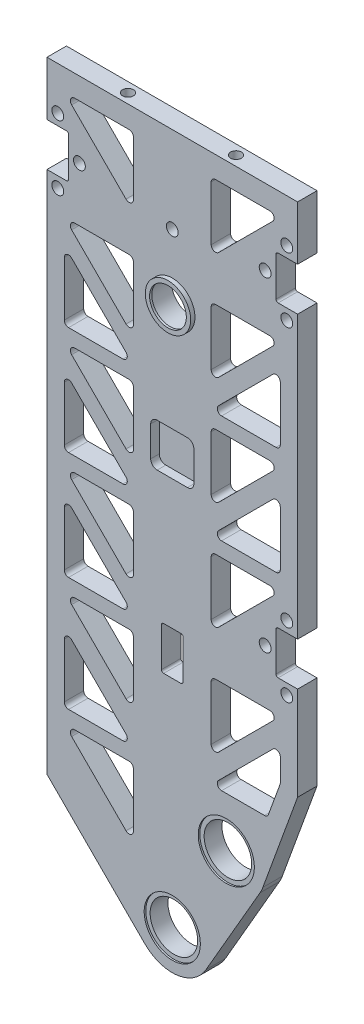
from build123d import *

# Parameters (mm, degrees)
SKETCH_1_R                   = 11
EXTRUDE_570_DEPTH            = 100
EXTRUDE_START                = -100
SKETCH_2_R                   = 11
EXTRUDE_879_DEPTH            = 100
EXTRUDE_2695_DEPTH           = 100
CUT_EXTRUDE_4152_DEPTH       = 534.010318849
CUT_EXTRUDE_4152_DEPTH_BACK  = 534.010318849
SKETCH_3_W                   = 90
SKETCH_3_H                   = 380
SKETCH_5_R                   = 2.5
EXTRUDE_4718_DEPTH           = 100
SKETCH_6_W                   = 191.177045066
SKETCH_6_H                   = 235.084722287
CUT_EXTRUDE_5032_DEPTH       = 84
SKETCH_7_R                   = 75
EXTRUDE_5320_DEPTH           = 5
CUT_EXTRUDE_6102_DEPTH       = 357.195171219
CUT_EXTRUDE_6102_DEPTH_BACK  = 357.195171219
FILLET_2_R                   = 2
MIRROR_START                 = 95
MIRROR_1_DEPTH               = 5
CUT_EXTRUDE_11155_DEPTH      = 357.195171219
CUT_EXTRUDE_11155_DEPTH_BACK = 357.195171219
SKETCH_12_W                  = 10
SKETCH_12_H                  = 20
FILLET_3_R                   = 1
CUT_EXTRUDE_START            = -5
CUT_EXTRUDE_12036_OUTLINE_R  = 5
CUT_EXTRUDE_12036_DEPTH      = 5
CUT_EXTRUDE_7_DEPTH          = 357.195171219
CUT_EXTRUDE_7_DEPTH_BACK     = 357.195171219
SKETCH_14_W                  = 10
SKETCH_14_H                  = 20
FILLET_4_R                   = 1
CUT_EXTRUDE_START_2          = -129
SKETCH_15_R                  = 11
CUT_EXTRUDE_8_DEPTH          = 129
SKETCH_16_R                  = 13
CUT_EXTRUDE_9_DEPTH          = 0.75
CUT_EXTRUDE_START_3          = -0.75
SKETCH_17_R                  = 13
CUT_EXTRUDE_10_DEPTH         = 0.75
SKETCH_18_R                  = 9.5
CUT_EXTRUDE_11_DEPTH         = 113
CUT_EXTRUDE_12_DEPTH         = 357.195171219
CUT_EXTRUDE_12_DEPTH_BACK    = 357.195171219
MOVE_FACE_1_BY               = 4
SKETCH_21_R                  = 2.5
CUT_EXTRUDE_13_DEPTH         = 17
SKETCH_22_R                  = 2.75
CUT_EXTRUDE_14_DEPTH         = 17
CUT_EXTRUDE_15_DEPTH         = 326.338285481
CUT_EXTRUDE_15_DEPTH_BACK    = 326.338285481
SKETCH_23_R                  = 2.75
SKETCH_24_W                  = 20
SKETCH_24_H                  = 20
CUT_EXTRUDE_16_DEPTH         = 4
FILLET_5_R                   = 3


# Read off the part's stored shape, not the designer's step: 镜向1, 电机安装轴承孔
with BuildPart() as part:
    # 草图1 → Extrude 570 (new body)
    with BuildSketch(Plane.XY):
        with BuildLine():
            Line((-18, 500), (-18, 0))
            ThreePointArc((-18, 0), (0, -18), (18, 0))
            Line((18, 0), (18, 500))
            ThreePointArc((18, 500), (0, 518), (-18, 500))
        make_face()
        with Locations((0, 500)):
            Circle(SKETCH_1_R, mode=Mode.SUBTRACT)
        Circle(SKETCH_1_R, mode=Mode.SUBTRACT)
    extrude(amount=EXTRUDE_570_DEPTH)

    # 草图2 → Extrude 879 (add)
    with BuildSketch(Plane.XY.offset(100).offset(EXTRUDE_START)):
        with BuildLine():
            Line((18, 61.301270189), (25, 61.301270189))
            ThreePointArc((25, 61.301270189), (40.588457268, 52.301270189), (40.588457268, 34.301270189))
            Line((40.588457268, 34.301270189), (15.588457268, -9))
            ThreePointArc((15.588457268, -9), (-4.658742812, -17.386664873), (-18, 0))
            Line((-18, 0), (-18, 61.301270189))
            Line((-18, 61.301270189), (18, 61.301270189))
        make_face()
        with Locations((25, 43.301270189)):
            Circle(SKETCH_2_R, mode=Mode.SUBTRACT)
        Circle(SKETCH_2_R, mode=Mode.SUBTRACT)
    extrude(amount=EXTRUDE_879_DEPTH)

    # 草图10 → Extrude 2695 (add)
    with BuildSketch(Plane(origin=(0, 0, 0), x_dir=(-1, 0, 0), z_dir=(0, 0, -1))):
        with BuildLine():
            Line((-41.914467174, 37.144907609), (-58, 81.339545828))
            Line((-58, 81.339545828), (-58, 320))
            Line((-58, 320), (-18, 320))
            Line((-18, 320), (-18, 61.301270189))
            Line((-18, 61.301270189), (-25, 61.301270189))
            ThreePointArc((-25, 61.301270189), (-39.744736797, 53.625646044), (-41.914467174, 37.144907609))
        make_face()
        with BuildLine():
            Line((12.727922061, -12.727922061), (58, 32.544155877))
            Line((58, 32.544155877), (58, 320))
            Line((58, 320), (18, 320))
            Line((18, 320), (18, 0))
            ThreePointArc((18, 0), (16.629831585, -6.888301783), (12.727922061, -12.727922061))
        make_face()
    extrude(amount=-EXTRUDE_2695_DEPTH)

    # 草图3 → Cut-Extrude 4152 (cut, two sides: drawn at the far end of the back side and taken through both)
    with BuildSketch(Plane.ZY.offset(18).offset(-CUT_EXTRUDE_4152_DEPTH_BACK)):
        with Locations((50, 150)):
            Rectangle(SKETCH_3_W, SKETCH_3_H)
    extrude(amount=CUT_EXTRUDE_4152_DEPTH + CUT_EXTRUDE_4152_DEPTH_BACK, mode=Mode.SUBTRACT)

    # 草图5 → Extrude 4718 (add)
    with BuildSketch(Plane.XY.offset(100)):
        with Locations(Location((0, 250, 0), (0, 0, 90))):
            Circle(SKETCH_5_R)
    extrude(amount=-EXTRUDE_4718_DEPTH)

    # 草图6 → Cut-Extrude 5032 (cut)
    with BuildSketch(Plane(origin=(18, 0, 0), x_dir=(0, 0, -1), z_dir=(1, 0, 0))):
        with Locations((-50.962374235, 437.542361144)):
            Rectangle(SKETCH_6_W, SKETCH_6_H)
    extrude(amount=-CUT_EXTRUDE_5032_DEPTH, mode=Mode.SUBTRACT)

    # 草图7 → Extrude 5320 (add)
    with BuildSketch(Plane(origin=(0, 320, 0), x_dir=(1, 0, 0), z_dir=(0, 1, 0))):
        with Locations(Location((0, -50, 0), (0, 0, 320.654170234))):
            Circle(SKETCH_7_R)
    extrude(amount=EXTRUDE_5320_DEPTH)

    # 草图10<3> → Cut-Extrude 6102 (cut, two sides: drawn at the far end of the back side and taken through both)
    with BuildSketch(Plane(origin=(0, 0, 0), x_dir=(-1, 0, 0), z_dir=(0, 0, -1)).offset(-CUT_EXTRUDE_6102_DEPTH_BACK)):
        Polygon((50, 310), (18, 310), (18, 278), align=None)
        Polygon((-18, 278), (-18, 310), (-50, 310), align=None)
        Polygon((-18, 227.925713543), (-18, 259.925713543), (-50, 259.925713543), align=None)
        Polygon((50, 259.925713543), (18, 259.925713543), (18, 227.925713543), align=None)
        Polygon((50, 248.612005044), (50, 216.612005044), (18, 216.612005044), align=None)
        Polygon((-50, 248.612005044), (-50, 216.612005044), (-18, 216.612005044), align=None)
        Polygon((-18, 177.851427085), (-18, 209.851427085), (-50, 209.851427085), align=None)
        Polygon((50, 209.851427085), (18, 209.851427085), (18, 177.851427085), align=None)
        Polygon((50, 198.537718586), (50, 166.537718586), (18, 166.537718586), align=None)
        Polygon((-50, 198.537718586), (-50, 166.537718586), (-18, 166.537718586), align=None)
        Polygon((-50, 159.777140628), (-18, 127.777140628), (-18, 159.777140628), align=None)
        Polygon((18, 159.777140628), (18, 127.777140628), (50, 159.777140628), align=None)
        Polygon((-50, 109.702854171), (-18, 77.702854171), (-18, 109.702854171), align=None)
        Polygon((18, 109.702854171), (18, 77.702854171), (50, 109.702854171), align=None)
        Polygon((-50, 98.389145672), (-50, 82.750161674), (-44.045077173, 66.389145672), (-18, 66.389145672), align=None)
        Polygon((18, 56.800140588), (18, 24.800140588), (50, 56.800140588), align=None)
        Polygon((50, 95.560718547), (50, 63.560718547), (18, 63.560718547), align=None)
        Polygon((50, 116.463432129), (18, 116.463432129), (50, 148.463432129), align=None)
    extrude(amount=CUT_EXTRUDE_6102_DEPTH + CUT_EXTRUDE_6102_DEPTH_BACK, mode=Mode.SUBTRACT)

    # 圆角2
    fillet_2_edges = [part.edges().sort_by_distance(p)[0] for p in [
        (50, 109.702854171, 2.5),
        (18, 109.702854171, 2.5),
        (18, 77.702854171, 2.5),
        (-18, 159.777140628, 2.5),
        (-50, 159.777140628, 2.5),
        (-18, 127.777140628, 2.5),
        (50, 159.777140628, 2.5),
        (18, 159.777140628, 2.5),
        (18, 127.777140628, 2.5),
        (50, 166.537718586, 2.5),
        (50, 198.537718586, 2.5),
        (18, 166.537718586, 2.5),
        (-50, 63.560718547, 2.5),
        (-18, 63.560718547, 2.5),
        (-50, 95.560718547, 2.5),
        (-50, 56.800140588, 2.5),
        (-18, 24.800140588, 2.5),
        (-18, 56.800140588, 2.5),
        (50, 82.750161674, 2.5),
        (50, 98.389145672, 2.5),
        (18, 66.389145672, 2.5),
        (44.045077173, 66.389145672, 2.5),
        (-18, 109.702854171, 2.5),
        (-50, 109.702854171, 2.5),
        (-18, 77.702854171, 2.5),
        (50, 310, 2.5),
        (18, 310, 2.5),
        (18, 278, 2.5),
        (50, 259.925713543, 2.5),
        (18, 259.925713543, 2.5),
        (18, 227.925713543, 2.5),
        (-50, 248.612005044, 2.5),
        (-50, 216.612005044, 2.5),
        (-18, 216.612005044, 2.5),
        (-18, 259.925713543, 2.5),
        (-50, 259.925713543, 2.5),
        (-18, 227.925713543, 2.5),
        (50, 216.612005044, 2.5),
        (50, 248.612005044, 2.5),
        (18, 216.612005044, 2.5),
        (50, 209.851427085, 2.5),
        (18, 209.851427085, 2.5),
        (18, 177.851427085, 2.5),
        (-50, 198.537718586, 2.5),
        (-50, 166.537718586, 2.5),
        (-18, 166.537718586, 2.5),
        (-18, 209.851427085, 2.5),
        (-50, 209.851427085, 2.5),
        (-18, 177.851427085, 2.5),
        (-50, 148.463432129, 2.5),
        (-50, 116.463432129, 2.5),
        (-18, 116.463432129, 2.5),
        (-18, 310, 2.5),
        (-50, 310, 2.5),
        (-18, 278, 2.5),
    ]]
    fillet(fillet_2_edges, radius=FILLET_2_R)

    # 镜向1 outline → 镜向1 (add)
    with BuildSketch(Plane.XY.offset(MIRROR_START)):
        with BuildLine():
            ThreePointArc((-50, 143.635005004), (-48.765366865, 145.482764069), (-46.585786438, 145.049218567))
            Line((-46.585786438, 145.049218567), (-50, 148.463432129))
            Line((-50, 148.463432129), (-50, 143.635005004))
        make_face()
        with BuildLine():
            Line((-18, 116.463432129), (-21.414213562, 119.877645691))
            ThreePointArc((-21.414213562, 119.877645691), (-20.98066806, 117.698065264), (-22.828427125, 116.463432129))
            Line((-22.828427125, 116.463432129), (-18, 116.463432129))
        make_face()
        with BuildLine():
            ThreePointArc((-48, 116.463432129), (-49.414213562, 117.049218567), (-50, 118.463432129))
            Line((-50, 118.463432129), (-50, 116.463432129))
            Line((-50, 116.463432129), (-48, 116.463432129))
        make_face()
        with BuildLine():
            ThreePointArc((-20, 310), (-18.585786438, 309.414213562), (-18, 308))
            Line((-18, 308), (-18, 310))
            Line((-18, 310), (-20, 310))
        make_face()
        with BuildLine():
            Line((-18, 278), (-18, 282.828427125))
            ThreePointArc((-18, 282.828427125), (-19.234633135, 280.98066806), (-21.414213562, 281.414213562))
            Line((-21.414213562, 281.414213562), (-18, 278))
        make_face()
        with BuildLine():
            ThreePointArc((-46.585786438, 306.585786438), (-47.01933194, 308.765366865), (-45.171572875, 310))
            Line((-45.171572875, 310), (-50, 310))
            Line((-50, 310), (-46.585786438, 306.585786438))
        make_face()
        with BuildLine():
            ThreePointArc((-20, 259.925713543), (-18.585786438, 259.339927105), (-18, 257.925713543))
            Line((-18, 257.925713543), (-18, 259.925713543))
            Line((-18, 259.925713543), (-20, 259.925713543))
        make_face()
        with BuildLine():
            Line((-18, 227.925713543), (-18, 232.754140667))
            ThreePointArc((-18, 232.754140667), (-19.234633135, 230.906381602), (-21.414213562, 231.339927105))
            Line((-21.414213562, 231.339927105), (-18, 227.925713543))
        make_face()
        with BuildLine():
            ThreePointArc((-46.585786438, 256.51149998), (-47.01933194, 258.691080407), (-45.171572875, 259.925713543))
            Line((-45.171572875, 259.925713543), (-50, 259.925713543))
            Line((-50, 259.925713543), (-46.585786438, 256.51149998))
        make_face()
        with BuildLine():
            ThreePointArc((-50, 243.783577919), (-48.765366865, 245.631336984), (-46.585786438, 245.197791481))
            Line((-46.585786438, 245.197791481), (-50, 248.612005044))
            Line((-50, 248.612005044), (-50, 243.783577919))
        make_face()
        with BuildLine():
            Line((-18, 216.612005044), (-21.414213562, 220.026218606))
            ThreePointArc((-21.414213562, 220.026218606), (-20.98066806, 217.846638179), (-22.828427125, 216.612005044))
            Line((-22.828427125, 216.612005044), (-18, 216.612005044))
        make_face()
        with BuildLine():
            ThreePointArc((-48, 216.612005044), (-49.414213563, 217.197791481), (-50, 218.612005044))
            Line((-50, 218.612005044), (-50, 216.612005044))
            Line((-50, 216.612005044), (-48, 216.612005044))
        make_face()
        with BuildLine():
            ThreePointArc((-20, 209.851427085), (-18.585786438, 209.265640647), (-18, 207.851427085))
            Line((-18, 207.851427085), (-18, 209.851427085))
            Line((-18, 209.851427085), (-20, 209.851427085))
        make_face()
        with BuildLine():
            Line((-18, 177.851427085), (-18, 182.67985421))
            ThreePointArc((-18, 182.67985421), (-19.234633135, 180.832095145), (-21.414213562, 181.265640648))
            Line((-21.414213562, 181.265640648), (-18, 177.851427085))
        make_face()
        with BuildLine():
            ThreePointArc((-46.585786438, 206.437213523), (-47.01933194, 208.61679395), (-45.171572875, 209.851427085))
            Line((-45.171572875, 209.851427085), (-50, 209.851427085))
            Line((-50, 209.851427085), (-46.585786438, 206.437213523))
        make_face()
        with BuildLine():
            ThreePointArc((-50, 193.709291462), (-48.765366865, 195.557050527), (-46.585786438, 195.123505024))
            Line((-46.585786438, 195.123505024), (-50, 198.537718586))
            Line((-50, 198.537718586), (-50, 193.709291462))
        make_face()
        with BuildLine():
            Line((-18, 166.537718586), (-21.414213562, 169.951932149))
            ThreePointArc((-21.414213562, 169.951932149), (-20.98066806, 167.772351722), (-22.828427125, 166.537718586))
            Line((-22.828427125, 166.537718586), (-18, 166.537718586))
        make_face()
        with BuildLine():
            ThreePointArc((-48, 166.537718586), (-49.414213562, 167.123505024), (-50, 168.537718586))
            Line((-50, 168.537718586), (-50, 166.537718586))
            Line((-50, 166.537718586), (-48, 166.537718586))
        make_face()
        with BuildLine():
            ThreePointArc((-20, 159.777140628), (-18.585786438, 159.19135419), (-18, 157.777140628))
            Line((-18, 157.777140628), (-18, 159.777140628))
            Line((-18, 159.777140628), (-20, 159.777140628))
        make_face()
        with BuildLine():
            Line((-18, 127.777140628), (-18, 132.605567753))
            ThreePointArc((-18, 132.605567753), (-19.234633135, 130.757808688), (-21.414213562, 131.19135419))
            Line((-21.414213562, 131.19135419), (-18, 127.777140628))
        make_face()
        with BuildLine():
            ThreePointArc((-46.585786438, 156.362927066), (-47.01933194, 158.542507493), (-45.171572875, 159.777140628))
            Line((-45.171572875, 159.777140628), (-50, 159.777140628))
            Line((-50, 159.777140628), (-46.585786438, 156.362927066))
        make_face()
        with BuildLine():
            ThreePointArc((-20, 109.702854171), (-18.585786438, 109.117067733), (-18, 107.702854171))
            Line((-18, 107.702854171), (-18, 109.702854171))
            Line((-18, 109.702854171), (-20, 109.702854171))
        make_face()
        with BuildLine():
            Line((-18, 77.702854171), (-18, 82.531281295))
            ThreePointArc((-18, 82.531281295), (-19.234633135, 80.68352223), (-21.414213562, 81.117067733))
            Line((-21.414213562, 81.117067733), (-18, 77.702854171))
        make_face()
        with BuildLine():
            ThreePointArc((-46.585786438, 106.288640608), (-47.01933194, 108.468221035), (-45.171572875, 109.702854171))
            Line((-45.171572875, 109.702854171), (-50, 109.702854171))
            Line((-50, 109.702854171), (-46.585786438, 106.288640608))
        make_face()
        with BuildLine():
            ThreePointArc((-50, 90.732291422), (-48.765366865, 92.580050487), (-46.585786438, 92.146504984))
            Line((-46.585786438, 92.146504984), (-50, 95.560718547))
            Line((-50, 95.560718547), (-50, 90.732291422))
        make_face()
        with BuildLine():
            Line((-18, 63.560718547), (-21.414213562, 66.974932109))
            ThreePointArc((-21.414213562, 66.974932109), (-20.98066806, 64.795351682), (-22.828427125, 63.560718547))
            Line((-22.828427125, 63.560718547), (-18, 63.560718547))
        make_face()
        with BuildLine():
            ThreePointArc((-48, 63.560718547), (-49.414213562, 64.146504984), (-50, 65.560718547))
            Line((-50, 65.560718547), (-50, 63.560718547))
            Line((-50, 63.560718547), (-48, 63.560718547))
        make_face()
        with BuildLine():
            ThreePointArc((-46.585786438, 53.385927026), (-47.01933194, 55.565507453), (-45.171572875, 56.800140588))
            Line((-45.171572875, 56.800140588), (-50, 56.800140588))
            Line((-50, 56.800140588), (-46.585786438, 53.385927026))
        make_face()
        with BuildLine():
            Line((-18, 56.800140588), (-20, 56.800140588))
            ThreePointArc((-20, 56.800140588), (-18.585786437, 56.214354151), (-18, 54.800140588))
            Line((-18, 54.800140588), (-18, 56.800140588))
        make_face()
        with BuildLine():
            ThreePointArc((-18, 29.628567713), (-19.234633135, 27.780808648), (-21.414213562, 28.214354151))
            Line((-21.414213562, 28.214354151), (-18, 24.800140588))
            Line((-18, 24.800140588), (-18, 29.628567713))
        make_face()
        with BuildLine():
            ThreePointArc((46.585786438, 94.974932109), (48.765366865, 95.408477612), (50, 93.560718547))
            Line((50, 93.560718547), (50, 98.389145672))
            Line((50, 98.389145672), (46.585786438, 94.974932109))
        make_face()
        with BuildLine():
            Line((50, 82.750161674), (50, 83.102815635))
            ThreePointArc((50, 83.102815635), (49.969615506, 82.75551928), (49.879385242, 82.418775349))
            Line((49.879385242, 82.418775349), (50, 82.750161674))
        make_face()
        with BuildLine():
            ThreePointArc((22.828427125, 66.389145672), (20.98066806, 67.623778807), (21.414213562, 69.803359234))
            Line((21.414213562, 69.803359234), (18, 66.389145672))
            Line((18, 66.389145672), (22.828427125, 66.389145672))
        make_face()
        with BuildLine():
            Line((44.045077173, 66.389145672), (44.524047338, 67.705105385))
            ThreePointArc((44.524047338, 67.705105385), (43.791814969, 66.750841583), (42.644662096, 66.389145672))
            Line((42.644662096, 66.389145672), (44.045077173, 66.389145672))
        make_face()
        with BuildLine():
            Line((18, 109.702854171), (18, 107.702854171))
            ThreePointArc((18, 107.702854171), (18.585786438, 109.117067733), (20, 109.702854171))
            Line((20, 109.702854171), (18, 109.702854171))
        make_face()
        with BuildLine():
            ThreePointArc((21.414213562, 81.117067733), (19.234633135, 80.68352223), (18, 82.531281295))
            Line((18, 82.531281295), (18, 77.702854171))
            Line((18, 77.702854171), (21.414213562, 81.117067733))
        make_face()
        with BuildLine():
            Line((50, 109.702854171), (45.171572875, 109.702854171))
            ThreePointArc((45.171572875, 109.702854171), (47.01933194, 108.468221035), (46.585786438, 106.288640608))
            Line((46.585786438, 106.288640608), (50, 109.702854171))
        make_face()
        with BuildLine():
            Line((18, 159.777140628), (18, 157.777140628))
            ThreePointArc((18, 157.777140628), (18.585786438, 159.19135419), (20, 159.777140628))
            Line((20, 159.777140628), (18, 159.777140628))
        make_face()
        with BuildLine():
            ThreePointArc((21.414213562, 131.19135419), (19.234633135, 130.757808688), (18, 132.605567753))
            Line((18, 132.605567753), (18, 127.777140628))
            Line((18, 127.777140628), (21.414213562, 131.19135419))
        make_face()
        with BuildLine():
            Line((50, 159.777140628), (45.171572875, 159.777140628))
            ThreePointArc((45.171572875, 159.777140628), (47.01933194, 158.542507493), (46.585786438, 156.362927066))
            Line((46.585786438, 156.362927066), (50, 159.777140628))
        make_face()
        with BuildLine():
            ThreePointArc((50, 168.537718586), (49.414213562, 167.123505024), (48, 166.537718586))
            Line((48, 166.537718586), (50, 166.537718586))
            Line((50, 166.537718586), (50, 168.537718586))
        make_face()
        with BuildLine():
            Line((18, 166.537718586), (22.828427125, 166.537718586))
            ThreePointArc((22.828427125, 166.537718586), (20.98066806, 167.772351722), (21.414213562, 169.951932149))
            Line((21.414213562, 169.951932149), (18, 166.537718586))
        make_face()
        with BuildLine():
            ThreePointArc((46.585786438, 195.123505024), (48.765366865, 195.557050527), (50, 193.709291462))
            Line((50, 193.709291462), (50, 198.537718586))
            Line((50, 198.537718586), (46.585786438, 195.123505024))
        make_face()
        with BuildLine():
            Line((18, 177.851427085), (21.414213562, 181.265640648))
            ThreePointArc((21.414213562, 181.265640648), (19.234633135, 180.832095145), (18, 182.67985421))
            Line((18, 182.67985421), (18, 177.851427085))
        make_face()
        with BuildLine():
            ThreePointArc((45.171572875, 209.851427085), (47.01933194, 208.61679395), (46.585786438, 206.437213523))
            Line((46.585786438, 206.437213523), (50, 209.851427085))
            Line((50, 209.851427085), (45.171572875, 209.851427085))
        make_face()
        with BuildLine():
            Line((18, 209.851427085), (18, 207.851427085))
            ThreePointArc((18, 207.851427085), (18.585786438, 209.265640647), (20, 209.851427085))
            Line((20, 209.851427085), (18, 209.851427085))
        make_face()
        with BuildLine():
            ThreePointArc((50, 218.612005044), (49.414213563, 217.197791481), (48, 216.612005044))
            Line((48, 216.612005044), (50, 216.612005044))
            Line((50, 216.612005044), (50, 218.612005044))
        make_face()
        with BuildLine():
            Line((18, 216.612005044), (22.828427125, 216.612005044))
            ThreePointArc((22.828427125, 216.612005044), (20.98066806, 217.846638179), (21.414213562, 220.026218606))
            Line((21.414213562, 220.026218606), (18, 216.612005044))
        make_face()
        with BuildLine():
            ThreePointArc((46.585786438, 245.197791481), (48.765366865, 245.631336984), (50, 243.783577919))
            Line((50, 243.783577919), (50, 248.612005044))
            Line((50, 248.612005044), (46.585786438, 245.197791481))
        make_face()
        with BuildLine():
            Line((18, 227.925713543), (21.414213562, 231.339927105))
            ThreePointArc((21.414213562, 231.339927105), (19.234633135, 230.906381602), (18, 232.754140667))
            Line((18, 232.754140667), (18, 227.925713543))
        make_face()
        with BuildLine():
            ThreePointArc((45.171572875, 259.925713543), (47.01933194, 258.691080407), (46.585786438, 256.51149998))
            Line((46.585786438, 256.51149998), (50, 259.925713543))
            Line((50, 259.925713543), (45.171572875, 259.925713543))
        make_face()
        with BuildLine():
            Line((18, 259.925713543), (18, 257.925713543))
            ThreePointArc((18, 257.925713543), (18.585786438, 259.339927105), (20, 259.925713543))
            Line((20, 259.925713543), (18, 259.925713543))
        make_face()
        with BuildLine():
            Line((18, 278), (21.414213562, 281.414213562))
            ThreePointArc((21.414213562, 281.414213562), (19.234633135, 280.98066806), (18, 282.828427125))
            Line((18, 282.828427125), (18, 278))
        make_face()
        with BuildLine():
            ThreePointArc((45.171572875, 310), (47.01933194, 308.765366865), (46.585786438, 306.585786438))
            Line((46.585786438, 306.585786438), (50, 310))
            Line((50, 310), (45.171572875, 310))
        make_face()
        with BuildLine():
            Line((18, 310), (18, 308))
            ThreePointArc((18, 308), (18.585786438, 309.414213562), (20, 310))
            Line((20, 310), (18, 310))
        make_face()
    extrude(amount=MIRROR_1_DEPTH)

    # 草图12 → Cut-Extrude 11155 (cut, two sides: drawn at the far end of the back side and taken through both)
    with BuildSketch(Plane(origin=(0, 0, 0), x_dir=(-1, 0, 0), z_dir=(0, 0, -1)).offset(-CUT_EXTRUDE_11155_DEPTH_BACK)):
        with Locations((-53, 285)):
            Rectangle(SKETCH_12_W, SKETCH_12_H)
        with Locations((-53, 134.702854171)):
            Rectangle(SKETCH_12_W, SKETCH_12_H)
        with Locations((53, 285)):
            Rectangle(SKETCH_12_W, SKETCH_12_H)
    extrude(amount=CUT_EXTRUDE_11155_DEPTH + CUT_EXTRUDE_11155_DEPTH_BACK, mode=Mode.SUBTRACT)

    # 圆角3
    fillet_3_edges = [part.edges().sort_by_distance(p)[0] for p in [
        (-48, 275, 2.5),
        (-48, 295, 2.5),
        (-48, 275, 97.5),
        (-48, 295, 97.5),
        (48, 144.702854171, 2.5),
        (48, 124.702854171, 2.5),
        (48, 144.702854171, 97.5),
        (48, 124.702854171, 97.5),
        (48, 295, 2.5),
        (48, 275, 2.5),
        (48, 295, 97.5),
        (48, 275, 97.5),
    ]]
    fillet(fillet_3_edges, radius=FILLET_3_R)

    # Cut-Extrude 12036 outline → Cut-Extrude 12036 (cut)
    with BuildSketch(Plane.XY.offset(5).offset(CUT_EXTRUDE_START)):
        with Locations((0, 250)):
            Circle(CUT_EXTRUDE_12036_OUTLINE_R)
    cut_extrude_12036 = extrude(amount=CUT_EXTRUDE_12036_DEPTH, mode=Mode.SUBTRACT)

    # 镜向2: Cut-Extrude 12036 across plane
    add(cut_extrude_12036.mirror(Plane(origin=(0, 0, 50), x_dir=(1, 0, 0), z_dir=(0, 0, -1))), mode=Mode.SUBTRACT)

    # 草图14 → 切除-拉伸7 (cut, two sides: drawn at the far end of the back side and taken through both)
    with BuildSketch(Plane(origin=(0, 0, 0), x_dir=(-1, 0, 0), z_dir=(0, 0, -1)).offset(-CUT_EXTRUDE_7_DEPTH_BACK)):
        with Locations((0, 110)):
            Rectangle(SKETCH_14_W, SKETCH_14_H)
    extrude(amount=CUT_EXTRUDE_7_DEPTH + CUT_EXTRUDE_7_DEPTH_BACK, mode=Mode.SUBTRACT)

    # 圆角4
    fillet_4_edges = [part.edges().sort_by_distance(p)[0] for p in [
        (5, 100, 2.5),
        (5, 120, 2.5),
        (-5, 120, 2.5),
        (-5, 100, 2.5),
        (5, 100, 97.5),
        (5, 120, 97.5),
        (-5, 120, 97.5),
        (-5, 100, 97.5),
    ]]
    fillet(fillet_4_edges, radius=FILLET_4_R)

    # 草图15 → 切除-拉伸8 (cut)
    with BuildSketch(Plane.XY.offset(100).offset(CUT_EXTRUDE_START_2)):
        with Locations((25, 43.301270189)):
            Circle(SKETCH_15_R)
    extrude(amount=CUT_EXTRUDE_8_DEPTH, mode=Mode.SUBTRACT)

    # 草图16 → 切除-拉伸9 (cut)
    with BuildSketch(Plane.XY.offset(100)):
        with Locations((25, 43.301270189)):
            Circle(SKETCH_16_R)
        Circle(SKETCH_16_R)
    extrude(amount=-CUT_EXTRUDE_9_DEPTH, mode=Mode.SUBTRACT)

    # 草图17 → 切除-拉伸10 (cut)
    with BuildSketch(Plane(origin=(0, 0, 0), x_dir=(-1, 0, 0), z_dir=(0, 0, -1)).offset(CUT_EXTRUDE_START_3)):
        with Locations(Location((0, 0, 0), (0, 0, 180))):
            Circle(SKETCH_17_R)
        with Locations(Location((-25, 43.301270189, 0), (0, 0, 180))):
            Circle(SKETCH_17_R)
    extrude(amount=CUT_EXTRUDE_10_DEPTH, mode=Mode.SUBTRACT)

    # 草图18 → 切除-拉伸11 (cut)
    with BuildSketch(Plane.XY.offset(100)):
        with Locations((0, 250)):
            Circle(SKETCH_18_R)
    extrude(amount=-CUT_EXTRUDE_11_DEPTH, mode=Mode.SUBTRACT)

    # 草图19 → 旋转1 (revolve)
    with BuildSketch(Plane(origin=(0, 0, 0), x_dir=(0, 0, -1), z_dir=(1, 0, 0)), mode=Mode.PRIVATE) as revolve_1_sk:
        Polygon((0, 239.5), (2, 239.5), (2, 241.5), (1, 241.5), (1, 240.5), (0, 240.5), align=None)
        Polygon((-100, 239.5), (-102, 239.5), (-102, 241.5), (-101, 241.5), (-101, 240.5), (-100, 240.5), align=None)
    revolve(revolve_1_sk.sketch.rotate(Axis((0, 250, 0), (0, 0, 1)), 270), axis=Axis((0, 250, 0), (0, 0, 1)))

    # 草图20 → 切除-拉伸12 (cut, two sides: drawn at the far end of the back side and taken through both)
    with BuildSketch(Plane(origin=(0, 0, 0), x_dir=(0, 0, -1), z_dir=(1, 0, 0)).offset(-CUT_EXTRUDE_12_DEPTH_BACK)):
        Polygon((25, 325), (-125, 325), (-125, 320), (-25.33563281, 320), (-25.33563281, -69.714061667), (25, -69.714061667), align=None)
    extrude(amount=CUT_EXTRUDE_12_DEPTH + CUT_EXTRUDE_12_DEPTH_BACK, mode=Mode.SUBTRACT)

    # Move Face 1: a face moved outward by 4.0
    extrude(part.faces().sort_by_distance((-0.85211942, 163.36467429, 95))[0], amount=MOVE_FACE_1_BY, dir=(0, 0, -1))

    # 草图21 → 切除-拉伸13 (cut)
    with BuildSketch(Plane(origin=(0, 320, 0), x_dir=(1, 0, 0), z_dir=(0, 1, 0))):
        with Locations(Location((-25, -95.5, 0), (0, 0, 270))):
            Circle(SKETCH_21_R)
        with Locations(Location((25, -95.5, 0), (0, 0, 270))):
            Circle(SKETCH_21_R)
    extrude(amount=-CUT_EXTRUDE_13_DEPTH, mode=Mode.SUBTRACT)

    # 草图22 → 切除-拉伸14 (cut)
    with BuildSketch(Plane.XY.offset(100)):
        with Locations((0, 280)):
            Circle(SKETCH_22_R)
    extrude(amount=-CUT_EXTRUDE_14_DEPTH, mode=Mode.SUBTRACT)

    # 草图23 → 切除-拉伸15 (cut, two sides: drawn at the far end of the back side and taken through both)
    with BuildSketch(Plane.XY.offset(100).offset(-CUT_EXTRUDE_15_DEPTH_BACK)):
        with Locations((53, 300)):
            Circle(SKETCH_23_R)
        with Locations((43, 285)):
            Circle(SKETCH_23_R)
        with Locations((53, 270)):
            Circle(SKETCH_23_R)
        with Locations((-53, 300)):
            Circle(SKETCH_23_R)
        with Locations((-43, 285)):
            Circle(SKETCH_23_R)
        with Locations((-53, 270)):
            Circle(SKETCH_23_R)
        with Locations((53, 149.702854171)):
            Circle(SKETCH_23_R)
        with Locations((43, 134.702854171)):
            Circle(SKETCH_23_R)
        with Locations((53, 119.702854171)):
            Circle(SKETCH_23_R)
    extrude(amount=CUT_EXTRUDE_15_DEPTH + CUT_EXTRUDE_15_DEPTH_BACK, mode=Mode.SUBTRACT)

    # 草图24 → 切除-拉伸16 (cut)
    with BuildSketch(Plane.XY.offset(100)):
        with Locations((0, 190)):
            Rectangle(SKETCH_24_W, SKETCH_24_H)
    extrude(amount=-CUT_EXTRUDE_16_DEPTH, mode=Mode.SUBTRACT)

    # 圆角5
    fillet_5_edges = [part.edges().sort_by_distance(p)[0] for p in [
        (-10, 180, 98),
        (-10, 200, 98),
        (10, 200, 98),
        (10, 180, 98),
    ]]
    fillet(fillet_5_edges, radius=FILLET_5_R)


solid = part.part
